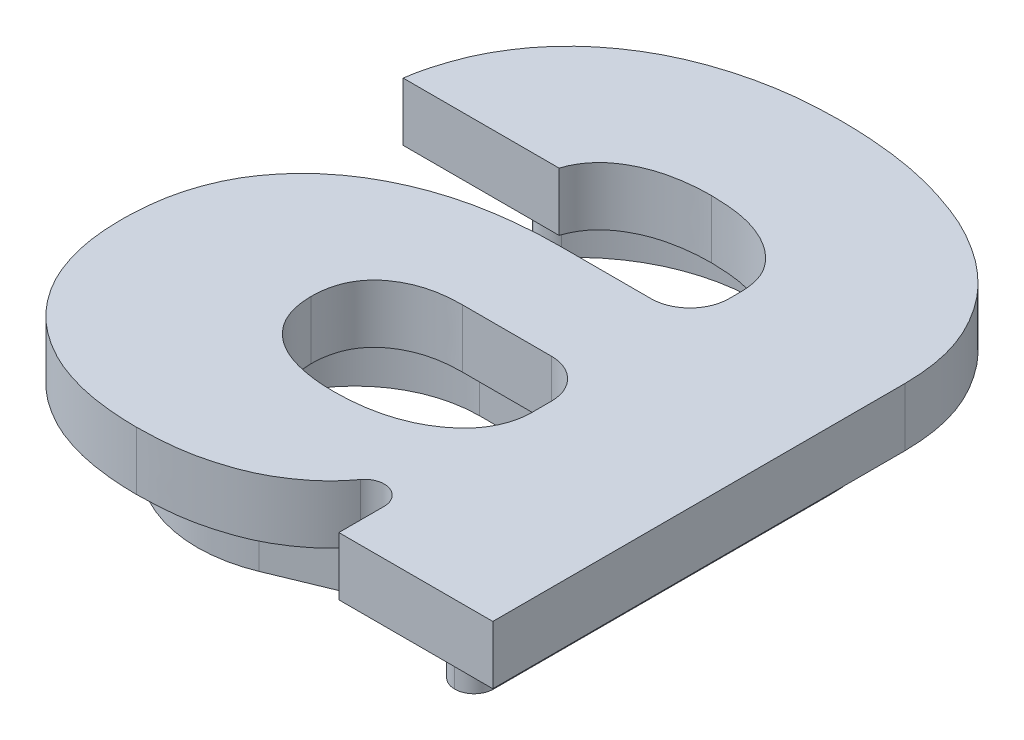
from build123d import *

# Parameters (mm, degrees)
EXTRUDE_A_DEPTH        = 15
EXTRUDE_START          = -15
EXTRUDE_1094_DEPTH     = 15
FILLET_1193_R          = 5
SKETCH_1687_R          = 1.5
CUT_EXTRUDE_1695_DEPTH = 209.716786496


# Read off the part's stored shape, not the designer's step: Крепёж подсветки
with BuildPart() as part:
    # Эскиз a → a (new body)
    with BuildSketch(Plane(origin=(0, 0, 0), x_dir=(1, 0, 0), z_dir=(0, 1, 0))):
        with BuildLine():
            Line((-74.520384615, 92.307692308), (-51.547628205, 92.307692308))
            ThreePointArc((-51.547628205, 92.307692308), (-44.476560393, 95.236624496), (-41.547628205, 102.307692308))
            Line((-41.547628205, 102.307692308), (-41.547628205, 105.528846154))
            add(Edge.make_bspline(
                [(-41.547628205, 105.528846154), (-41.589366101, 107.948222673), (-42.311968813, 111.725236431), (-45.364659999, 115.744047227), (-48.360941467, 118.363419904), (-52.088329813, 120.464585708), (-58.167173781, 122.692568444), (-63.272576427, 122.986040169), (-66.747948718, 123.076923077)],
                knots=[0, 0, 0, 0, 0.214119089, 0.321196014, 0.436321482, 0.560424661, 0.693541545, 1, 1, 1, 1], degree=3))
            add(Edge.make_bspline(
                [(-66.747948718, 123.076923077), (-69.893564207, 123.080605188), (-74.455436152, 122.668604623), (-80.155209455, 121.17254296), (-83.769465044, 119.551365088), (-86.900070149, 117.611248095), (-90.219050211, 114.535370047), (-91.874811485, 111.626200807), (-92.509166667, 109.575320513)],
                knots=[0, 0, 0, 0, 0.303354176, 0.439638221, 0.566536184, 0.684131842, 0.793521478, 1, 1, 1, 1], degree=3))
            Line((-92.509166667, 109.575320513), (-132.653397436, 109.575320513))
            add(Edge.make_bspline(
                [(-132.653397436, 109.575320513), (-132.184201783, 113.087140675), (-130.795624145, 118.15659858), (-128.19280088, 124.601587438), (-125.664760884, 129.035887057), (-122.794152767, 133.238985665), (-119.441255285, 137.074157728), (-115.741741521, 140.63288151), (-111.633413237, 143.831306263), (-107.17861289, 146.729787101), (-102.346451132, 149.255837099), (-97.167941577, 151.412429984), (-91.660712646, 153.212656031), (-85.838670743, 154.658039782), (-77.530242739, 156.068161016), (-71.096580585, 156.398822022), (-66.747948718, 156.41025641)],
                knots=[0, 0, 0, 0, 0.119573608, 0.177335258, 0.234813152, 0.291996949, 0.349368073, 0.406922364, 0.465525295, 0.525338083, 0.586609194, 0.649830595, 0.71502075, 0.782562113, 0.852721586, 1, 1, 1, 1], degree=3))
            add(Edge.make_bspline(
                [(-66.747948718, 156.41025641), (-61.968988459, 156.392663239), (-54.947667648, 155.985446946), (-45.873687377, 154.467159525), (-39.564934091, 152.874349906), (-33.638289979, 150.844811848), (-28.074188881, 148.591400848), (-23.054822979, 145.757241268), (-18.412257057, 142.708045953), (-14.279258644, 139.235840775), (-10.583454679, 135.469274407), (-7.463127164, 131.289600948), (-4.754692452, 126.858179176), (-2.609029305, 122.086942327), (-0.539010898, 115.22571593), (-0.042432857, 109.783488856), (0, 106.129807692)],
                knots=[0, 0, 0, 0, 0.153336078, 0.225033571, 0.294857118, 0.361781701, 0.425911033, 0.487078596, 0.546369069, 0.603853698, 0.659902843, 0.715253447, 0.770797687, 0.826214567, 0.882595092, 1, 1, 1, 1], degree=3))
            Line((0, 106.129807692), (0, 0))
            Line((0, 0), (-39.624551282, 0))
            Line((-39.624551282, 0), (-39.624551282, 11.657391173))
            ThreePointArc((-39.624551282, 11.657391173), (-43.086222414, 16.414863643), (-48.677969, 14.584814068))
            add(Edge.make_bspline(
                [(-48.677969, 14.584814068), (-48.678325474, 14.58432048), (-49.401940271, 13.582431718), (-50.961876586, 11.646783223), (-53.623463899, 8.973036858), (-56.637344543, 6.600374565), (-59.881982972, 4.423762658), (-63.376944677, 2.531245898), (-67.128788275, 0.97098444), (-71.104205055, -0.290819203), (-75.283415797, -1.358329915), (-81.319724293, -2.329736811), (-86.001669974, -2.515385574), (-89.183846154, -2.564102564)],
                knots=[0.292616743, 0.292616743, 0.292616743, 0.292616743, 0.292645016, 0.35000617, 0.407914969, 0.467504342, 0.527902135, 0.58925158, 0.651818691, 0.716369187, 0.782878648, 0.852032496, 1, 1, 1, 1], degree=3))
            add(Edge.make_bspline(
                [(-89.183846154, -2.564102564), (-92.696143139, -2.563171923), (-97.849868685, -2.196003557), (-104.478841851, -0.984436312), (-109.0198168, 0.374534999), (-113.322329381, 1.979867452), (-117.275485322, 4.103907156), (-121.009551864, 6.500500507), (-124.400450579, 9.307764851), (-127.456932274, 12.431818371), (-130.105112643, 15.854413488), (-132.382989435, 19.53713378), (-134.225784363, 23.504991494), (-135.607165112, 27.750868467), (-137.073506247, 33.860713869), (-137.353543033, 38.681644677), (-137.380961538, 41.947115385)],
                knots=[0, 0, 0, 0, 0.14197724, 0.20850209, 0.272085146, 0.333471514, 0.393870961, 0.453195829, 0.512670492, 0.571491635, 0.629616792, 0.687328924, 0.746291247, 0.806071694, 0.867647864, 1, 1, 1, 1], degree=3))
            add(Edge.make_bspline(
                [(-137.380961538, 41.947115385), (-137.332467508, 45.646769435), (-136.933434838, 51.128528105), (-135.125246993, 58.077186495), (-133.275165684, 62.877808634), (-130.906181844, 67.376308359), (-127.932476106, 71.505264958), (-124.521902456, 75.401738528), (-120.534775434, 78.896783937), (-116.135748383, 82.077955173), (-111.293718358, 84.790354521), (-106.093815223, 87.128667042), (-100.516275036, 89.046984257), (-94.550941241, 90.532221393), (-85.87260868, 91.922444883), (-79.127187938, 92.338184598), (-74.520384615, 92.307692308)],
                knots=[0, 0, 0, 0, 0.122343482, 0.180191603, 0.236436754, 0.291855148, 0.34751151, 0.404039302, 0.462434158, 0.522138981, 0.582945316, 0.645299727, 0.710129718, 0.777384643, 0.847976876, 1, 1, 1, 1], degree=3))
        make_face()
        with BuildLine():
            Line((-41.547628205, 51.883012821), (-41.547628205, 56.666666667))
            ThreePointArc((-41.547628205, 56.666666667), (-44.476560393, 63.737734479), (-51.547628205, 66.666666667))
            Line((-51.547628205, 66.666666667), (-74.520384615, 66.666666667))
            add(Edge.make_bspline(
                [(-74.520384615, 66.666666667), (-77.459174879, 66.68393859), (-81.738468089, 66.213760779), (-86.881795523, 64.191745397), (-90.052532288, 62.16107684), (-92.662808931, 59.591750957), (-95.240506421, 55.33378405), (-95.839873717, 51.528118554), (-95.834487179, 48.998397436)],
                knots=[0, 0, 0, 0, 0.282762219, 0.407045605, 0.527609379, 0.641843836, 0.755746823, 1, 1, 1, 1], degree=3))
            add(Edge.make_bspline(
                [(-95.834487179, 48.998397436), (-95.826902001, 46.42039786), (-95.153043318, 42.544390821), (-92.423278743, 38.198829097), (-89.658226599, 35.491864605), (-86.123297055, 33.343685501), (-80.167419961, 31.247123144), (-75.200693161, 30.773101529), (-71.755961538, 30.769230769)],
                knots=[0, 0, 0, 0, 0.228228434, 0.334915955, 0.447160503, 0.565939888, 0.69613054, 1, 1, 1, 1], degree=3))
            add(Edge.make_bspline(
                [(-71.755961538, 30.769230769), (-67.687660759, 30.750752975), (-61.763464194, 31.372978505), (-54.528827005, 33.91364293), (-50.017400723, 36.506867579), (-46.272064617, 39.641329037), (-42.638710532, 44.530412222), (-41.486486562, 48.951844733), (-41.547628205, 51.883012821)],
                knots=[0, 0, 0, 0, 0.298193556, 0.431193385, 0.558664864, 0.67724112, 0.786373724, 1, 1, 1, 1], degree=3))
        make_face(mode=Mode.SUBTRACT)
    extrude(amount=EXTRUDE_A_DEPTH)

    # Extrude 1094 outline → Extrude 1094 (add)
    with BuildSketch(Plane(origin=(0, 0, 0), x_dir=(1, 0, 0), z_dir=(0, 1, 0)).offset(EXTRUDE_START)):
        with BuildLine():
            Line((-14.81, 10), (-14.81, 101.565711454))
            add(Edge.make_bspline(
                [(-14.81, 101.565711454), (-14.81, 101.612022024), (-14.810006363, 101.666053427), (-14.809998503, 101.711426594), (-14.809995845, 101.721375015), (-14.810004459, 101.756282462), (-14.810014982, 101.782366792), (-14.810123087, 101.863259592), (-14.810294374, 101.914214988), (-14.8115487, 102.165928085), (-14.813928721, 102.376049407), (-14.825372169, 102.996414929), (-14.838735188, 103.415625309), (-14.897262051, 104.682757141), (-14.960869212, 105.544638231), (-15.23764203, 108.181621113), (-15.536056837, 110.012286961), (-16.452438092, 113.816788933), (-17.073726625, 115.798299033), (-18.12070982, 118.320379841), (-18.344451314, 118.829028204), (-18.824715001, 119.855484505), (-19.079305824, 120.369484975), (-19.875876314, 121.888477462), (-20.435909948, 122.841728589), (-22.144564335, 125.511140829), (-23.330825124, 127.047850705), (-25.060076918, 129.055090484), (-25.639080499, 129.687261773), (-26.821283975, 130.907438074), (-27.429686102, 131.501164405), (-29.300795226, 133.226444634), (-30.60008163, 134.293804691), (-33.256697624, 136.247834676), (-34.59812335, 137.122905005), (-37.227465665, 138.677834746), (-38.520504182, 139.359759314), (-41.08910959, 140.591691662), (-42.392476868, 141.155195752), (-45.078921678, 142.18487648), (-46.46022499, 142.651074348), (-49.242409104, 143.458924621), (-50.615606518, 143.792529508), (-53.246456237, 144.338837547), (-54.501369015, 144.550529948), (-56.89017795, 144.890362616), (-58.031047351, 145.019582143), (-60.188239432, 145.222701824), (-61.207778538, 145.296888517), (-62.646655656, 145.38422246), (-63.111786456, 145.409380912), (-63.779269838, 145.4425267), (-63.997318535, 145.452837411), (-64.327812943, 145.46779346), (-64.437764643, 145.472659113), (-64.637142876, 145.481378736), (-64.725740737, 145.485196586), (-64.81755561, 145.48918334)],
                knots=[0, 0, 0, 0, 0.00390625, 0.00390625, 0.004882812, 0.004882812, 0.005859375, 0.005859375, 0.0078125, 0.0078125, 0.015625, 0.015625, 0.03125, 0.03125, 0.0625, 0.0625, 0.125, 0.125, 0.1875, 0.1875, 0.203125, 0.203125, 0.21875, 0.21875, 0.25, 0.25, 0.3125, 0.3125, 0.34375, 0.34375, 0.375, 0.375, 0.4375, 0.4375, 0.5, 0.5, 0.5625, 0.5625, 0.625, 0.625, 0.6875, 0.6875, 0.75, 0.75, 0.8125, 0.8125, 0.875, 0.875, 0.9375, 0.9375, 0.96875, 0.96875, 0.984375, 0.984375, 0.9921875, 0.9921875, 1, 1, 1, 1], degree=3))
            ThreePointArc((-64.81755561, 145.48918334), (-91.861898077, 139.965177291), (-113.128486668, 122.368492604))
            Line((-113.128486668, 122.368492604), (-105.075812225, 116.439375106))
            ThreePointArc((-105.075812225, 116.439375106), (-87.5449936, 130.944959126), (-65.251363357, 135.498597229))
            add(Edge.make_bspline(
                [(-24.81, 101.565711454), (-24.81, 101.611072021), (-24.8100067, 101.664977692), (-24.809998231, 101.713861025), (-24.809995991, 101.720730661), (-24.810003705, 101.751991204), (-24.81001441, 101.775256808), (-24.810097442, 101.837387696), (-24.810223517, 101.875079949), (-24.810816214, 101.994020093), (-24.811482134, 102.076107482), (-24.813345903, 102.237412326), (-24.814551869, 102.317607478), (-24.822004066, 102.721601633), (-24.832415376, 103.04797941), (-24.877952185, 104.033870956), (-24.927288684, 104.701342825), (-25.140912771, 106.736669351), (-25.369506022, 108.133465886), (-26.062900224, 111.012201775), (-26.526740223, 112.4874878), (-27.302219745, 114.355542636), (-27.466273396, 114.728378426), (-27.818087824, 115.480303142), (-28.007779968, 115.863199537), (-28.587345027, 116.968381038), (-29.002450618, 117.675890428), (-30.278634143, 119.669658125), (-31.161492276, 120.816266052), (-32.509048615, 122.380450458), (-32.95116937, 122.86316181), (-33.873071868, 123.814676167), (-34.34765138, 124.277757853), (-35.801188796, 125.618010719), (-36.819268916, 126.454484784), (-38.887822212, 127.975974971), (-39.954199252, 128.672590693), (-42.051932033, 129.913139354), (-43.078165846, 130.455007138), (-45.180372882, 131.463249525), (-46.228545717, 131.91612782), (-48.400826848, 132.748736034), (-49.526709363, 133.128444723), (-51.752888832, 133.774850431), (-52.880869174, 134.049594969), (-55.047539492, 134.499514021), (-56.088968992, 134.675699286), (-58.11942304, 134.964552282), (-59.101474343, 135.076140753), (-60.992705265, 135.254217719), (-61.898668459, 135.320419675), (-63.209976797, 135.400010716), (-63.638563151, 135.423217592), (-64.259832507, 135.45406849), (-64.462730891, 135.46366479), (-64.773216197, 135.477715356), (-64.878517584, 135.482376258), (-65.070236186, 135.490760894), (-65.157482074, 135.494520748), (-65.251363357, 135.498597229)],
                knots=[0, 0, 0, 0, 0.00390625, 0.00390625, 0.004882813, 0.004882813, 0.005859375, 0.005859375, 0.0078125, 0.0078125, 0.01171875, 0.01171875, 0.015625, 0.015625, 0.03125, 0.03125, 0.0625, 0.0625, 0.125, 0.125, 0.1875, 0.1875, 0.203125, 0.203125, 0.21875, 0.21875, 0.25, 0.25, 0.3125, 0.3125, 0.34375, 0.34375, 0.375, 0.375, 0.4375, 0.4375, 0.5, 0.5, 0.5625, 0.5625, 0.625, 0.625, 0.6875, 0.6875, 0.75, 0.75, 0.8125, 0.8125, 0.875, 0.875, 0.9375, 0.9375, 0.96875, 0.96875, 0.984375, 0.984375, 0.9921875, 0.9921875, 1, 1, 1, 1], degree=3))
            Line((-24.81, 101.565711454), (-24.81, 84.129963833))
            Line((-24.81, 84.129963833), (-77.521909704, 84.129963833))
            ThreePointArc((-77.521909704, 84.129963833), (-104.388017101, 74.42893441), (-118.858606699, 49.801719073))
            ThreePointArc((-118.858606699, 49.801719073), (-106.545965079, 16.268384214), (-71.201961241, 11.083108607))
            Line((-71.201961241, 11.083108607), (-34.853620694, 26.06451926))
            Line((-34.853620694, 26.06451926), (-38.664260489, 35.310005961))
            Line((-38.664260489, 35.310005961), (-75.012601036, 20.328595309))
            ThreePointArc((-75.012601036, 20.328595309), (-100.240275639, 24.029716617), (-109.02873429, 47.964980546))
            ThreePointArc((-109.02873429, 47.964980546), (-97.999252951, 66.735840583), (-77.521909704, 74.129963833))
            Line((-77.521909704, 74.129963833), (-24.81, 74.129963833))
            Line((-24.81, 74.129963833), (-24.81, 10))
            Line((-24.81, 10), (-14.81, 10))
        make_face()
    extrude(amount=EXTRUDE_1094_DEPTH)

    # Fillet 1193
    fillet_1193_edges = [part.edges().sort_by_distance(p)[0] for p in [
        (-113.128486668, -7.5, -122.368492604),
        (-105.075812225, -7.5, -116.439375106),
        (-14.81, -7.5, -10),
        (-24.81, -7.5, -10),
        (-34.853620694, -7.5, -26.06451926),
        (-38.664260489, -7.5, -35.310005961),
        (-24.81, -7.5, -74.129963833),
        (-24.81, -7.5, -84.129963833),
    ]]
    fillet(fillet_1193_edges, radius=FILLET_1193_R - 0.0001)  # a hair under: the kernel refuses the full size

    # Sketch 1687 → Cut-Extrude 1695 (cut, through all)
    with BuildSketch(Plane(origin=(0, 0, 0), x_dir=(1, 0, 0), z_dir=(0, 1, 0))):
        with Locations(Location((-65, 140.5, 0), (0, 0, 270))):
            Circle(SKETCH_1687_R)
        with Locations(Location((-104.1, 20.75, 0), (0, 0, 270))):
            Circle(SKETCH_1687_R)
        with Locations(Location((-19.81, 15, 0), (0, 0, 270))):
            Circle(SKETCH_1687_R)
    extrude(amount=-CUT_EXTRUDE_1695_DEPTH, mode=Mode.SUBTRACT)


solid = part.part
